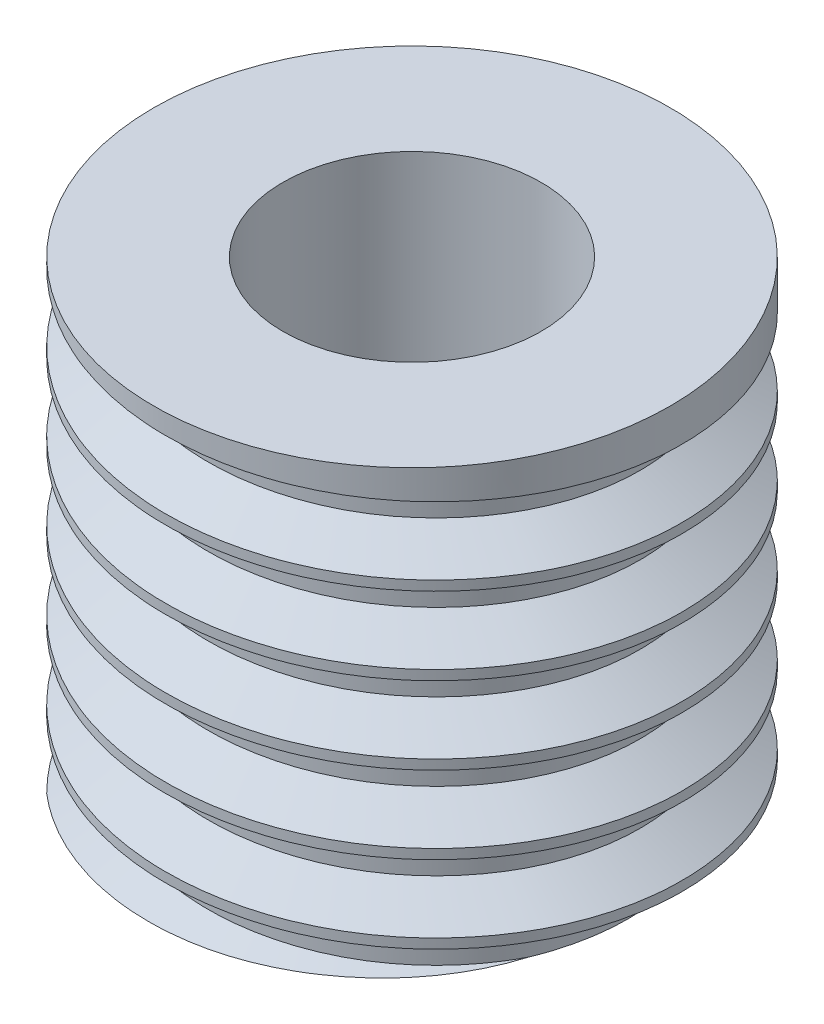
from build123d import *

# Parameters (mm, degrees)
SKETCH1_R           = 5
SKETCH1_R_2         = 2.5
BOSS_EXTRUDE1_DEPTH = 9
THREAD1_PITCH       = 1.5


with BuildPart() as part:
    # Sketch1 → Boss-Extrude1 (new body)
    with BuildSketch(Plane(origin=(0, 0, 0), x_dir=(1, 0, 0), z_dir=(0, 1, 0))):
        with Locations(Location((0, 0, 0), (0, 0, 270))):
            Circle(SKETCH1_R)
        with Locations(Location((0, 0, 0), (0, 0, 270))):
            Circle(SKETCH1_R_2, mode=Mode.SUBTRACT)
    extrude(amount=BOSS_EXTRUDE1_DEPTH)

    # Thread1: the profile of Thread Profile1 profile screwed along a left-hand helix of 6.666667 turns, 8 arcs to a turn; built about Z, then put on its axis
    thread1_z = Axis((0, 0, 0), (0, 0, 1))
    thread1_corners = [(5.0003, 0, -0.000173205), (5.0003, 0, 1.312673201), (4.188101188, 0, 0.843749998), (4.188101188, 0, 0.468749998)]
    with BuildLine(mode=Mode.PRIVATE) as thread1_profile:
        Line(thread1_corners[0], thread1_corners[1])
        Line(thread1_corners[1], thread1_corners[2])
        Line(thread1_corners[2], thread1_corners[3])
        Line(thread1_corners[3], thread1_corners[0])
    thread1_cap = Face(thread1_profile.wire())
    thread1_turn_angles = [0, -22.5, -45, -67.5, -90, -112.5, -135, -157.5, -180, -202.5, -225, -247.5, -270, -292.5, -315, -337.5, -360]
    thread1_turn_weights = [1, 0.9238795325112867, 1, 0.9238795325112867, 1, 0.9238795325112867, 1, 0.9238795325112867, 1, 0.9238795325112867, 1, 0.9238795325112867, 1, 0.9238795325112867, 1, 0.9238795325112867, 1]
    thread1_turn_rails = [Edge.make_bspline([Vector(p[0], p[1], 0).rotate(thread1_z, thread1_turn_angles[k]) / thread1_turn_weights[k] + Vector(0, 0, p[2] + -THREAD1_PITCH * thread1_turn_angles[k] / 360) for k in range(17)], [0, 0, 0, 1, 1, 2, 2, 3, 3, 4, 4, 5, 5, 6, 6, 7, 7, 8, 8, 8], 2, thread1_turn_weights) for p in thread1_corners]
    thread1_turn_sides = [Face.make_surface_from_curves(thread1_turn_rails[p[0]], thread1_turn_rails[p[1]]) for p in [(0, 1), (1, 2), (2, 3), (3, 0)]]
    thread1_last_angles = [-2160, -2182.5, -2205, -2227.5, -2250, -2272.5, -2295, -2317.5, -2340, -2362.5, -2385, -2392.5, -2400]
    thread1_last_weights = [1, 0.9238795325112867, 1, 0.9238795325112867, 1, 0.9238795325112867, 1, 0.9238795325112867, 1, 0.9238795325112867, 1, 0.9914448613738109, 1]
    thread1_last_rails = [Edge.make_bspline([Vector(p[0], p[1], 0).rotate(thread1_z, thread1_last_angles[k]) / thread1_last_weights[k] + Vector(0, 0, p[2] + -THREAD1_PITCH * thread1_last_angles[k] / 360) for k in range(13)], [0, 0, 0, 1, 1, 2, 2, 3, 3, 4, 4, 5, 5, 6, 6, 6], 2, thread1_last_weights) for p in thread1_corners]
    thread1_last_sides = [Face.make_surface_from_curves(thread1_last_rails[p[0]], thread1_last_rails[p[1]]) for p in [(0, 1), (1, 2), (2, 3), (3, 0)]]
    thread1 = Plane(origin=(0, 9, 0), x_dir=(-1, 0, 0), z_dir=(0, -1, 0)) * Solid(Shell([*[p.moved(Location((0, 0, THREAD1_PITCH * i))) for i in range(6) for p in thread1_turn_sides], *thread1_last_sides, thread1_cap, thread1_cap.rotate(thread1_z, -2400).moved(Location((0, 0, -THREAD1_PITCH * -2400 / 360)))]))
    add(thread1, mode=Mode.SUBTRACT)


solid = part.part
